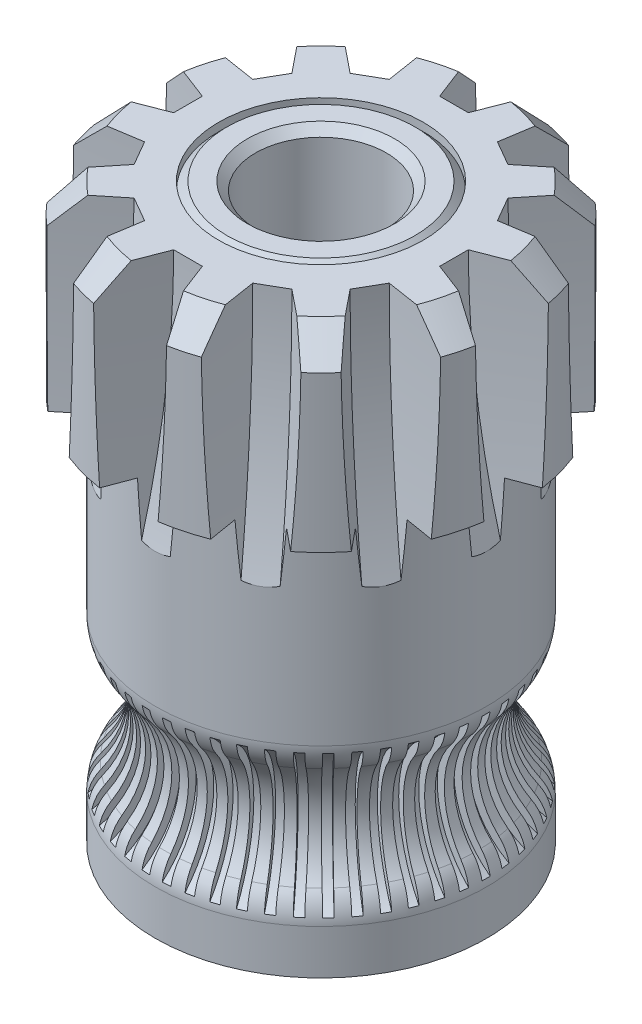
from build123d import *

# Parameters (mm, degrees)
CIRPATTERN1_COUNT   = 12
CUT_EXTRUDE1_DEPTH  = 0.1
CIRPATTERN2_COUNT   = 50
SKETCH7_R           = 2.5
SKETCH7_R_2         = 1.6
BOSS_EXTRUDE1_DEPTH = 14
CHAMFER1_SIZE       = 0.2


with BuildPart() as part:
    # Sketch1 → Revolve1 (revolve)
    with BuildSketch(Plane.XY, mode=Mode.PRIVATE) as revolve1_sk:
        with BuildLine():
            Line((4.05, 0), (4.05, 1.089502683))
            ThreePointArc((4.05, 1.089502683), (3.988958206, 1.433533914), (3.813285024, 1.735564577))
            ThreePointArc((3.813285024, 1.735564577), (3.35, 3), (3.813285024, 4.264435423))
            ThreePointArc((3.813285024, 4.264435423), (3.988958206, 4.566466086), (4.05, 4.910497317))
            Line((4.05, 4.910497317), (4.05, 9.5))
            Line((4.05, 9.5), (4.75, 9.5))
            Line((4.75, 9.5), (4.75, 13.3))
            Line((4.75, 13.3), (4.05, 14))
            Line((4.05, 14), (2.5, 14))
            Line((2.5, 14), (2.5, 0))
            Line((2.5, 0), (4.05, 0))
        make_face()
    revolve(revolve1_sk.sketch.rotate(Axis((0, 0, 0), (0, 1, 0)), 90), axis=Axis((0, 0, 0), (0, 1, 0)))

    # Cut-Sweep1: sweep along a path in Sketch5
    with BuildLine(Plane.XY) as cut_sweep1_path:
        CenterArc((24.75, 14), 20, 0, 360)
    # Sketch4 → Cut-Sweep1 (sweep, cut)
    with BuildSketch(Plane(origin=(0, 14, 0), x_dir=(1, 0, 0), z_dir=(0, 1, 0))):
        Polygon((3.25, -0.35), (3.25, 0.35), (4.75, 0.927555259), (4.75, -0.927555259), align=None)
    cut_sweep1 = sweep(path=cut_sweep1_path.line, mode=Mode.SUBTRACT)

    # CirPattern1: Cut-Sweep1 ×12 about axis
    cirpattern1_axis = Axis((0, 0, 0), (0, -1, 0))
    for i in range(1, CIRPATTERN1_COUNT):
        add(cut_sweep1.rotate(cirpattern1_axis, i * 360 / CIRPATTERN1_COUNT), mode=Mode.SUBTRACT)

    # Sketch6 → Cut-Extrude1 (cut, symmetric)
    with BuildSketch(Plane.XY):
        with BuildLine():
            Line((5.63162394, 5.132598728), (5.631263211, 0.867346418))
            ThreePointArc((5.631263211, 0.867346418), (3.150000008, 3.000182438), (5.63162394, 5.132598728))
        make_face()
    cut_extrude1 = extrude(amount=CUT_EXTRUDE1_DEPTH, both=True, mode=Mode.SUBTRACT)

    # CirPattern2: Cut-Extrude1 ×50 about axis
    cirpattern2_axis = Axis((0, 0, 0), (0, 1, 0))
    for i in range(1, CIRPATTERN2_COUNT):
        add(cut_extrude1.rotate(cirpattern2_axis, i * 360 / CIRPATTERN2_COUNT), mode=Mode.SUBTRACT)


with BuildPart() as body_2:
    # Sketch7 → Boss-Extrude1 (new body)
    with BuildSketch(Plane(origin=(0, 0, 0), x_dir=(1, 0, 0), z_dir=(0, 1, 0))):
        with Locations(Location((0, 0, 0), (0, 0, 270))):
            Circle(SKETCH7_R)
        with Locations(Location((0, 0, 0), (0, 0, 270))):
            Circle(SKETCH7_R_2, mode=Mode.SUBTRACT)
    extrude(amount=BOSS_EXTRUDE1_DEPTH)

    # Chamfer1
    chamfer1_edges = [body_2.edges().sort_by_distance(p)[0] for p in [
        (0, 14, -2.5),
        (0, 0, -2.5),
        (0, 0, -1.6),
        (0, 14, -1.6),
    ]]
    chamfer(chamfer1_edges, length=CHAMFER1_SIZE)


solid = Compound([part.part, body_2.part])
